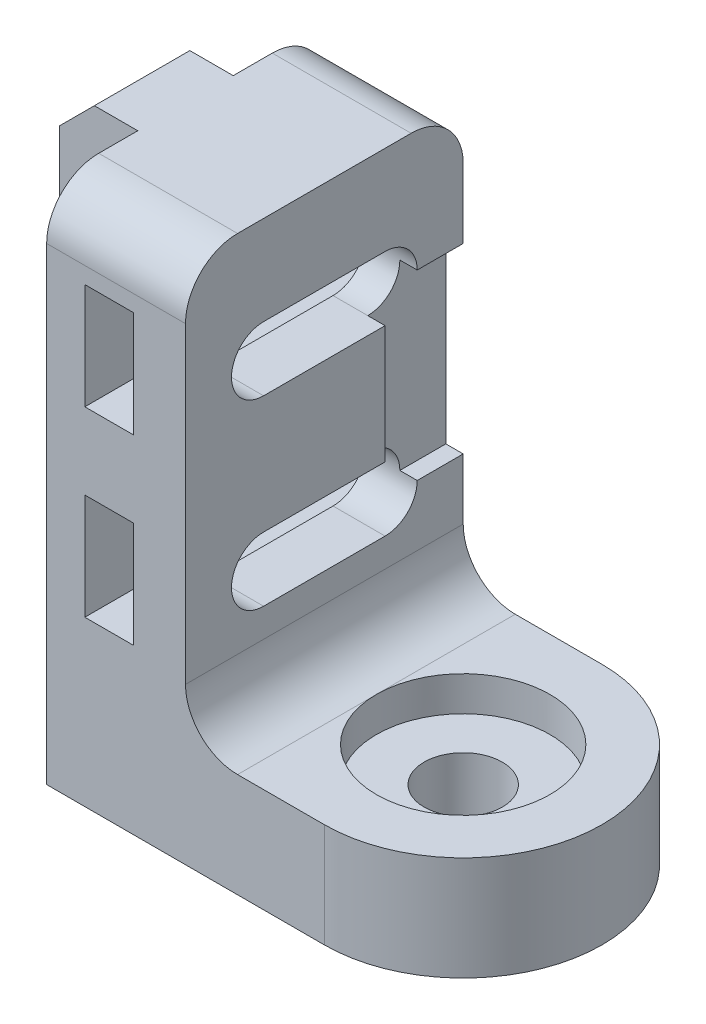
from build123d import *

# Parameters (mm, degrees)
SKETCH1_W           = 16
SKETCH1_H           = 30
BOSS_EXTRUDE1_DEPTH = 8
SKETCH2_W           = 5.5
SKETCH2_H           = 30
BOSS_EXTRUDE2_DEPTH = 4.5
CHAMFER1_SIZE       = 2
SKETCH6_R           = 2.25
BOSS_EXTRUDE3_DEPTH = 6
FILLET6_R           = 3
CUT_EXTRUDE1_START  = -3
SKETCH7_W           = 16
SKETCH7_H           = 6.1
CUT_EXTRUDE1_DEPTH  = 2.8
CUT_EXTRUDE2_DEPTH  = 5
SKETCH9_W           = 4.5
SKETCH9_H           = 10.5
CUT_EXTRUDE3_DEPTH  = 1
SKETCH10_R          = 5
CUT_EXTRUDE4_DEPTH  = 2
FILLET7_R           = 3


with BuildPart() as part:
    # Sketch1 → Boss-Extrude1 (new body)
    with BuildSketch(Plane(origin=(0, 0, 0), x_dir=(0, 0, -1), z_dir=(1, 0, 0))):
        with Locations((-40.846556001, 12.91146402)):
            Rectangle(SKETCH1_W, SKETCH1_H)
    extrude(amount=BOSS_EXTRUDE1_DEPTH)

    # Sketch2 → Boss-Extrude2 (add)
    with BuildSketch(Plane.ZY):
        with Locations((40.846556001, 12.91146402)):
            Rectangle(SKETCH2_W, SKETCH2_H)
    extrude(amount=BOSS_EXTRUDE2_DEPTH)

    # Chamfer1
    chamfer1_edges = [part.edges().sort_by_distance(p)[0] for p in [
        (-4.5, -2.08853598, 40.846556001),
        (-4.5, 27.91146402, 40.846556001),
    ]]
    chamfer(chamfer1_edges, length=CHAMFER1_SIZE)

    # Sketch6 → Boss-Extrude3 (add)
    with BuildSketch(Plane.XZ.offset(2.08853598)):
        with BuildLine():
            Line((8, 48.846556001), (16, 48.846556001))
            ThreePointArc((16, 48.846556001), (24, 40.846556001), (16, 32.846556001))
            Line((16, 32.846556001), (8, 32.846556001))
            Line((8, 32.846556001), (8, 48.846556001))
        make_face()
        with Locations((16, 40.846556001)):
            Circle(SKETCH6_R, mode=Mode.SUBTRACT)
    extrude(amount=-BOSS_EXTRUDE3_DEPTH)

    # Fillet6
    fillet6_edges = [part.edges().sort_by_distance(p)[0] for p in [
        (8, 3.91146402, 40.846556001),
    ]]
    fillet(fillet6_edges, radius=FILLET6_R)

    # Sketch7 → Cut-Extrude1 (cut)
    with BuildSketch(Plane(origin=(8, 0, 0), x_dir=(0, 0, -1), z_dir=(1, 0, 0)).offset(CUT_EXTRUDE1_START)):
        with Locations((-40.846556001, 20.91146402)):
            Rectangle(SKETCH7_W, SKETCH7_H)
        with Locations((-40.846556001, 10.41146402)):
            Rectangle(SKETCH7_W, SKETCH7_H)
    extrude(amount=-CUT_EXTRUDE1_DEPTH, mode=Mode.SUBTRACT)

    # Sketch8 → Cut-Extrude2 (cut)
    with BuildSketch(Plane(origin=(8, 0, 0), x_dir=(0, 0, -1), z_dir=(1, 0, 0))):
        with BuildLine():
            Line((-44.346556001, 22.76146402), (-37.346556001, 22.76146402))
            ThreePointArc((-37.346556001, 22.76146402), (-35.496556001, 20.91146402), (-37.346556001, 19.06146402))
            Line((-37.346556001, 19.06146402), (-44.346556001, 19.06146402))
            ThreePointArc((-44.346556001, 19.06146402), (-46.196556001, 20.91146402), (-44.346556001, 22.76146402))
        make_face()
        with BuildLine():
            Line((-44.346556001, 12.26146402), (-37.346556001, 12.26146402))
            ThreePointArc((-37.346556001, 12.26146402), (-35.496556001, 10.41146402), (-37.346556001, 8.56146402))
            Line((-37.346556001, 8.56146402), (-44.346556001, 8.56146402))
            ThreePointArc((-44.346556001, 8.56146402), (-46.196556001, 10.41146402), (-44.346556001, 12.26146402))
        make_face()
    extrude(amount=-CUT_EXTRUDE2_DEPTH, mode=Mode.SUBTRACT)

    # Sketch9 → Cut-Extrude3 (cut)
    with BuildSketch(Plane(origin=(8, 0, 0), x_dir=(0, 0, -1), z_dir=(1, 0, 0))):
        with Locations((-35.096556001, 15.66146402)):
            Rectangle(SKETCH9_W, SKETCH9_H)
    extrude(amount=-CUT_EXTRUDE3_DEPTH, mode=Mode.SUBTRACT)

    # Sketch10 → Cut-Extrude4 (cut)
    with BuildSketch(Plane(origin=(0, 3.91146402, 0), x_dir=(1, 0, 0), z_dir=(0, 1, 0))):
        with Locations((16, -40.846556001)):
            Circle(SKETCH10_R)
    extrude(amount=-CUT_EXTRUDE4_DEPTH, mode=Mode.SUBTRACT)

    # Fillet7
    fillet7_edges = [part.edges().sort_by_distance(p)[0] for p in [
        (4, 27.91146402, 32.846556001),
        (4, 27.91146402, 48.846556001),
    ]]
    fillet(fillet7_edges, radius=FILLET7_R)


solid = part.part
